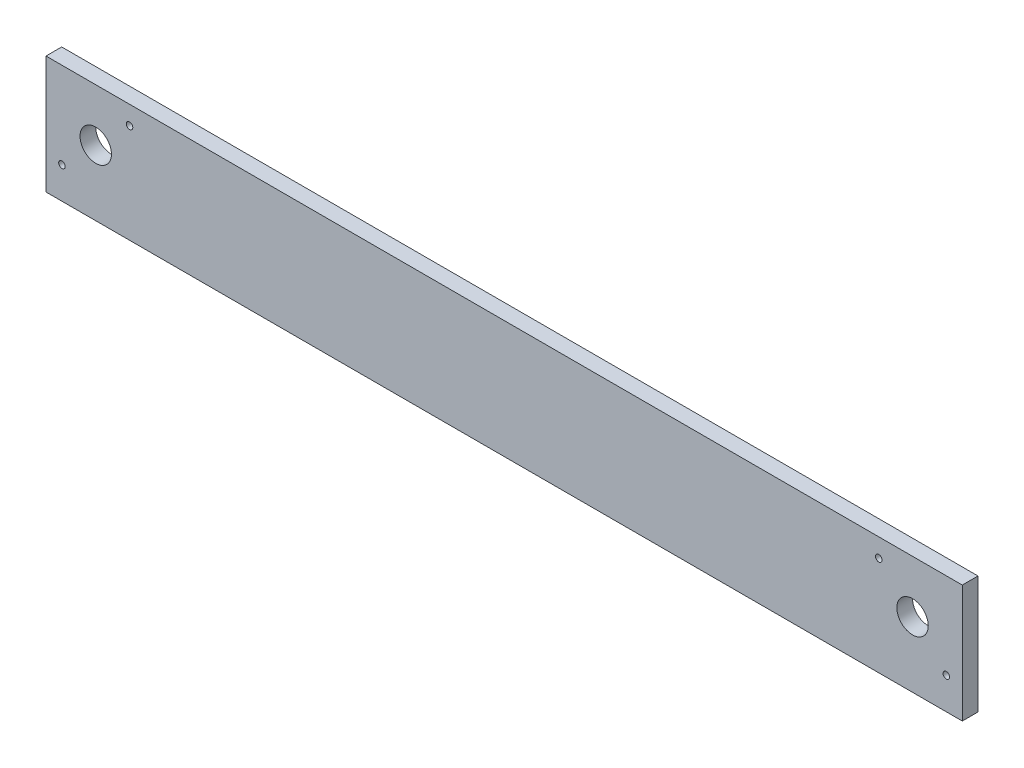
from build123d import *

# Parameters (mm, degrees)
CROQUIS1_W              = 350
CROQUIS1_H              = 45
SALIENTE_EXTRUIR1_DEPTH = 6
CROQUIS2_R              = 6
CROQUIS2_R_2            = 1.25
CORTAR_EXTRUIR1_DEPTH   = 353.932004783


with BuildPart() as part:
    # Croquis1 → Saliente-Extruir1 (new body)
    with BuildSketch(Plane.XY):
        with Locations((-175, -22.5)):
            Rectangle(CROQUIS1_W, CROQUIS1_H)
    extrude(amount=SALIENTE_EXTRUIR1_DEPTH)

    # Croquis2 → Cortar-Extruir1 (cut, through all)
    with BuildSketch(Plane.XY.offset(6)):
        with Locations((-331, -20)):
            Circle(CROQUIS2_R)
        with Locations((-19, -20)):
            Circle(CROQUIS2_R)
        with Locations((-318.095301243, -7.095301243)):
            Circle(CROQUIS2_R_2)
        with Locations((-343.904698757, -32.904698757)):
            Circle(CROQUIS2_R_2)
        with Locations((-31.904698757, -7.095301243)):
            Circle(CROQUIS2_R_2)
        with Locations((-6.095301243, -32.904698757)):
            Circle(CROQUIS2_R_2)
    extrude(amount=-CORTAR_EXTRUIR1_DEPTH, mode=Mode.SUBTRACT)


solid = part.part
